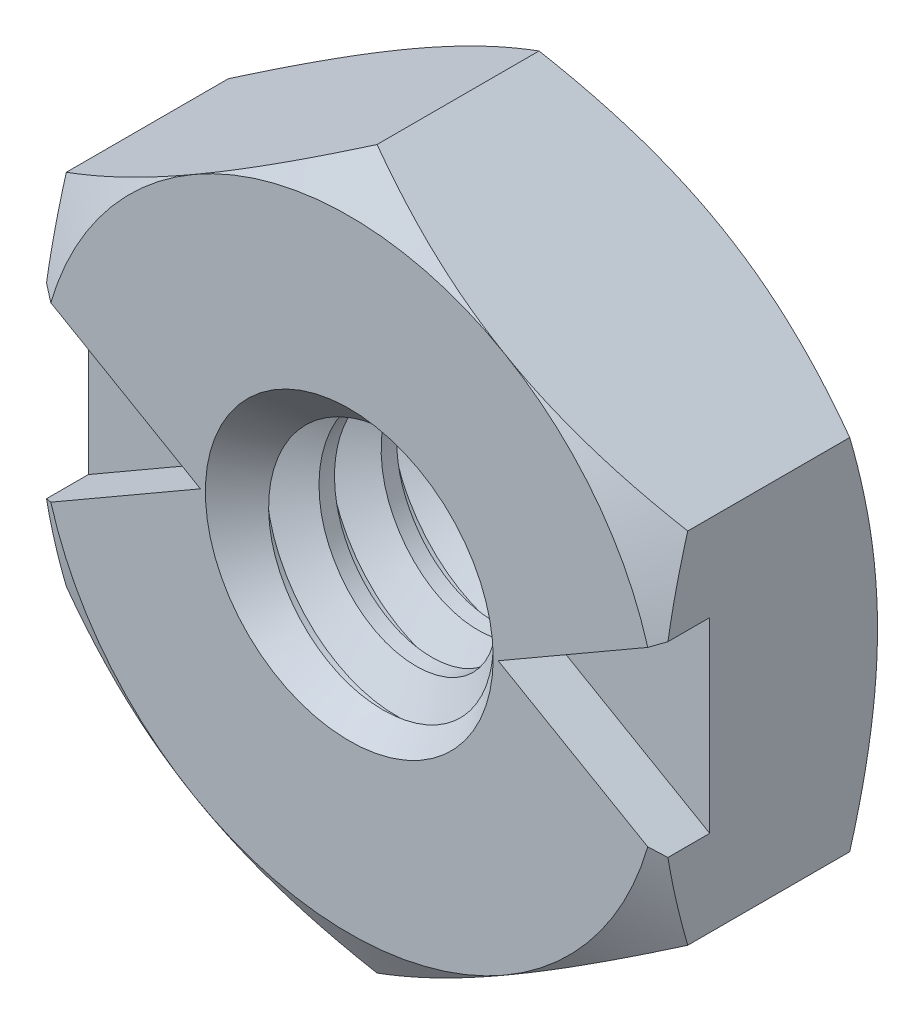
from build123d import *

# Parameters (mm, degrees)
EXTRUDE1_DEPTH               = 2.778125
SKETCH2_OUTSIDE_W            = 38.99
SKETCH2_OUTSIDE_H            = 40.218
SKETCH2_OUTSIDE_R            = 3.96875
CUT_EXTRUDE1_DEPTH           = 7.668602339
CUT_EXTRUDE1_DRAFT           = 60
SKETCH3_OUTSIDE_W            = 38.99
SKETCH3_OUTSIDE_H            = 40.218
SKETCH3_OUTSIDE_R            = 3.96875
CUT_EXTRUDE2_DEPTH           = 7.668602339
CUT_EXTRUDE2_DRAFT           = 60
SKETCH4_R                    = 1.7526
CUT_EXTRUDE3_DEPTH           = 7.668602339
SWEEP1_PITCH                 = 0.79375
SKETCH7_R                    = 1.838525958
CUT_EXTRUDE4_OTHER_WAY_DEPTH = 7.998893709
SKETCH8_R                    = 1.838525958
CUT_EXTRUDE5_OTHER_WAY_DEPTH = 7.668602441
CUT_EXTRUDE6_DEPTH           = 0.635


with BuildPart() as part:
    # Sketch1 → Extrude1 (new body)
    with BuildSketch(Plane.XY):
        Polygon((0, 4.582717762), (-3.96875, 2.291358881), (-3.96875, -2.291358881), (0, -4.582717762), (3.96875, -2.291358881), (3.96875, 2.291358881), align=None)
    extrude(amount=EXTRUDE1_DEPTH)


with BuildPart() as cut_extrude1_tool:
    # Sketch2 outside → Cut-Extrude1 (with draft: the straight prism first)
    with BuildSketch(Plane(origin=(0, 0, 2.778125), x_dir=(-1, 0, 0), z_dir=(0, 0, -1))):
        Rectangle(SKETCH2_OUTSIDE_W, SKETCH2_OUTSIDE_H)
        Circle(SKETCH2_OUTSIDE_R, mode=Mode.SUBTRACT)
    extrude(amount=CUT_EXTRUDE1_DEPTH)
    # Cut-Extrude1: the draft: its side faces are tilted about the plane it starts from
    cut_extrude1_sides = [cut_extrude1_tool.faces().sort_by_distance(p)[0] for p in [
        (0, -20.109, -1.05617617),
        (-19.495, 0, -1.05617617),
        (0, 20.109, -1.05617617),
        (19.495, 0, -1.05617617),
        (3.96875, 0, -1.05617617),
    ]]
    draft(cut_extrude1_sides, Plane(origin=(0, 0, 2.778125), x_dir=(-1, 0, 0), z_dir=(0, 0, -1)), CUT_EXTRUDE1_DRAFT)


with BuildPart() as part_1:
    add(part.part)

    # Cut-Extrude1: cut by cut_extrude1_tool
    add(cut_extrude1_tool.part, mode=Mode.SUBTRACT)


with BuildPart() as cut_extrude2_tool:
    # Sketch3 outside → Cut-Extrude2 (with draft: the straight prism first)
    with BuildSketch(Plane.XY):
        Rectangle(SKETCH3_OUTSIDE_W, SKETCH3_OUTSIDE_H)
        Circle(SKETCH3_OUTSIDE_R, mode=Mode.SUBTRACT)
    extrude(amount=CUT_EXTRUDE2_DEPTH)
    # Cut-Extrude2: the draft: its side faces are tilted about the plane it starts from
    cut_extrude2_sides = [cut_extrude2_tool.faces().sort_by_distance(p)[0] for p in [
        (0, -20.109, 3.83430117),
        (19.495, 0, 3.83430117),
        (0, 20.109, 3.83430117),
        (-19.495, 0, 3.83430117),
        (-3.96875, 0, 3.83430117),
    ]]
    draft(cut_extrude2_sides, Plane.XY, CUT_EXTRUDE2_DRAFT)


with BuildPart() as part_2:
    add(part_1.part)

    # Cut-Extrude2: cut by cut_extrude2_tool
    add(cut_extrude2_tool.part, mode=Mode.SUBTRACT)

    # Sketch4 → Cut-Extrude3 (cut, through all)
    with BuildSketch(Plane(origin=(0, 0, 0), x_dir=(-1, 0, 0), z_dir=(0, 0, -1))):
        Circle(SKETCH4_R)
    extrude(amount=-CUT_EXTRUDE3_DEPTH, mode=Mode.SUBTRACT)

    # Sweep1: the profile of Sketch6 screwed along a right-hand helix of 4.5 turns, 6 arcs to a turn; built about Z, then put on its axis
    sweep1_z = Axis((0, 0, 0), (0, 0, 1))
    sweep1_corners = [(1.795562979, 0, -0.719335938), (1.32297021, 0, -0.446484375), (1.32297021, 0, -0.248046875), (1.795562979, 0, 0.024804688)]
    with BuildLine(mode=Mode.PRIVATE) as sweep1_profile:
        Line(sweep1_corners[0], sweep1_corners[1])
        Line(sweep1_corners[1], sweep1_corners[2])
        Line(sweep1_corners[2], sweep1_corners[3])
        Line(sweep1_corners[3], sweep1_corners[0])
    sweep1_cap = Face(sweep1_profile.wire())
    sweep1_turn_angles = [0, 30, 60, 90, 120, 150, 180, 210, 240, 270, 300, 330, 360]
    sweep1_turn_weights = [1, 0.8660254037844387, 1, 0.8660254037844387, 1, 0.8660254037844387, 1, 0.8660254037844387, 1, 0.8660254037844387, 1, 0.8660254037844387, 1]
    sweep1_turn_rails = [Edge.make_bspline([Vector(p[0], p[1], 0).rotate(sweep1_z, sweep1_turn_angles[k]) / sweep1_turn_weights[k] + Vector(0, 0, p[2] + SWEEP1_PITCH * sweep1_turn_angles[k] / 360) for k in range(13)], [0, 0, 0, 1, 1, 2, 2, 3, 3, 4, 4, 5, 5, 6, 6, 6], 2, sweep1_turn_weights) for p in sweep1_corners]
    sweep1_turn_sides = [Face.make_surface_from_curves(sweep1_turn_rails[p[0]], sweep1_turn_rails[p[1]]) for p in [(0, 1), (1, 2), (2, 3), (3, 0)]]
    sweep1_last_angles = [1440, 1470, 1500, 1530, 1560, 1590, 1620]
    sweep1_last_weights = [1, 0.8660254037844387, 1, 0.8660254037844387, 1, 0.8660254037844297, 1]
    sweep1_last_rails = [Edge.make_bspline([Vector(p[0], p[1], 0).rotate(sweep1_z, sweep1_last_angles[k]) / sweep1_last_weights[k] + Vector(0, 0, p[2] + SWEEP1_PITCH * sweep1_last_angles[k] / 360) for k in range(7)], [0, 0, 0, 1, 1, 2, 2, 3, 3, 3], 2, sweep1_last_weights) for p in sweep1_corners]
    sweep1_last_sides = [Face.make_surface_from_curves(sweep1_last_rails[p[0]], sweep1_last_rails[p[1]]) for p in [(0, 1), (1, 2), (2, 3), (3, 0)]]
    sweep1 = Plane(origin=(0, 0, 2.778125), x_dir=(0, 1, 0), z_dir=(0, 0, -1)) * Solid(Shell([*[p.moved(Location((0, 0, SWEEP1_PITCH * i))) for i in range(4) for p in sweep1_turn_sides], *sweep1_last_sides, sweep1_cap, sweep1_cap.rotate(sweep1_z, 1620).moved(Location((0, 0, SWEEP1_PITCH * 1620 / 360)))]))
    add(sweep1)

    # Cut-Extrude4 cone 1 section (through the dimple's axis) → Cut-Extrude4 (revolve, cut)
    with BuildSketch(Plane.YZ):
        Polygon((0, 0), (1.838525958, 0), (0, 1.838525958), align=None)
    revolve(axis=Axis((0, 0, 0), (0, 0, 1)), mode=Mode.SUBTRACT)

    # Sketch7 → Cut-Extrude4 other way (cut)
    with BuildSketch(Plane(origin=(0, 0, 0), x_dir=(-1, 0, 0), z_dir=(0, 0, -1))):
        Circle(SKETCH7_R)
    extrude(amount=CUT_EXTRUDE4_OTHER_WAY_DEPTH, mode=Mode.SUBTRACT)

    # Cut-Extrude5 cone 1 section (through the dimple's axis) → Cut-Extrude5 (revolve, cut)
    with BuildSketch(Plane(origin=(0, 0, 2.778125), x_dir=(0, -1, 0), z_dir=(1, 0, 0))):
        Polygon((0, 0), (1.838525958, 0), (0, 1.838525958), align=None)
    revolve(axis=Axis((0, 0, 2.778125), (0, 0, -1)), mode=Mode.SUBTRACT)

    # Sketch8 → Cut-Extrude5 other way (cut)
    with BuildSketch(Plane.XY.offset(2.778125)):
        Circle(SKETCH8_R)
    extrude(amount=CUT_EXTRUDE5_OTHER_WAY_DEPTH, mode=Mode.SUBTRACT)

    # Sketch9 → Cut-Extrude6 (cut)
    with BuildSketch(Plane.XY.offset(2.778125)):
        Polygon((-1.902025958, 0), (-3.96875, 1.193223682), (-3.96875, -1.193223682), align=None)
        Polygon((3.96875, -1.193223682), (1.902025958, 0), (3.96875, 1.193223682), align=None)
    extrude(amount=-CUT_EXTRUDE6_DEPTH, mode=Mode.SUBTRACT)


solid = part_2.part
